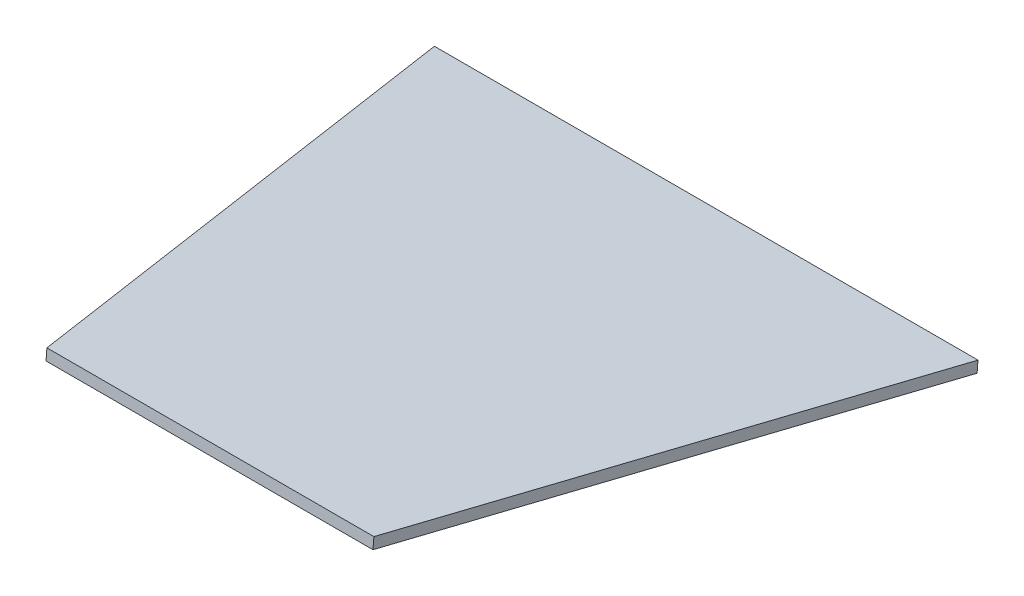
from build123d import *

# Parameters (mm, degrees)
BOSS_EXTRUDE1_DEPTH = 12.7


with BuildPart() as part:
    # Sketch1 → Boss-Extrude1 (new body)
    with BuildSketch(Plane(origin=(-0.000141256, -1762.284451008, 145.376956024), x_dir=(-0.9999999999999969, 7.961414168714261e-08, -6.567661367452003e-09), z_dir=(-7.988457756299225e-08, -0.9966146823530273, 0.08221420143970283))):
        Polygon((927.932358907, -1893.28840213), (1306.839320026, -1893.28840213), (1432.352062754, -1316.739819061), (802.419616179, -1316.739819061), align=None)
    extrude(amount=BOSS_EXTRUDE1_DEPTH)


solid = part.part
